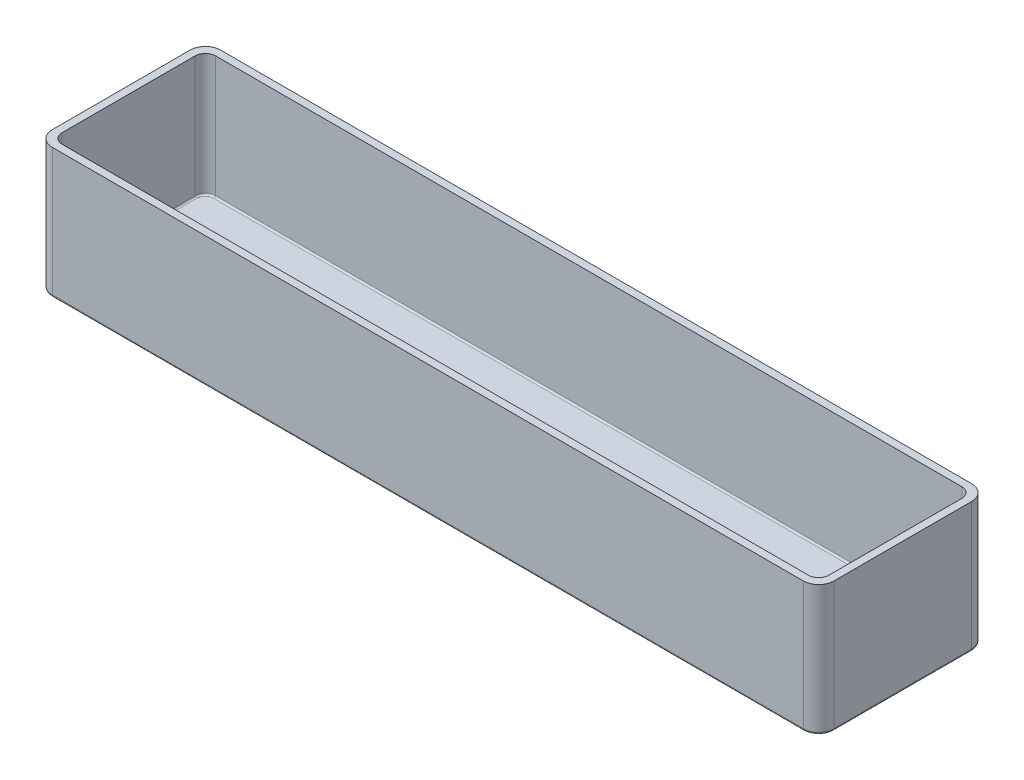
from build123d import *

# Parameters (mm, degrees)
SKETCH1_W           = 242.7986
SKETCH1_H           = 52.2986
SKETCH1_W_2         = 238.125
SKETCH1_H_2         = 47.625
BOSS_EXTRUDE1_DEPTH = 38.1
SKETCH2_W           = 242.7986
SKETCH2_H           = 52.2986
BOSS_EXTRUDE2_DEPTH = 2.3368
FILLET1_R           = 3.175
FILLET2_R           = 4.7625
SKETCH4_R           = 12.065
CUT_EXTRUDE2_DEPTH  = 131.601342739
FILLET4_R           = 0.508
FILLET5_R           = 0.762


with BuildPart() as part:
    # Sketch1 → Boss-Extrude1 (new body)
    with BuildSketch(Plane(origin=(0, 0, 0), x_dir=(1, 0, 0), z_dir=(0, 1, 0))):
        Rectangle(SKETCH1_W, SKETCH1_H)
        Rectangle(SKETCH1_W_2, SKETCH1_H_2, mode=Mode.SUBTRACT)
    extrude(amount=BOSS_EXTRUDE1_DEPTH)

    # Sketch2 → Boss-Extrude2 (add)
    with BuildSketch(Plane.XZ):
        Rectangle(SKETCH2_W, SKETCH2_H)
        with BuildLine():
            ThreePointArc((105.1493, 1.8243), (107.2493, 3.9243), (105.1493, 6.0243))
            ThreePointArc((105.1493, 6.0243), (103.0493, 3.9243), (105.1493, 1.8243))
        make_face(mode=Mode.SUBTRACT)
        with BuildLine():
            ThreePointArc((74.1493, 1.8243), (76.2493, 3.9243), (74.1493, 6.0243))
            ThreePointArc((74.1493, 6.0243), (72.0493, 3.9243), (74.1493, 1.8243))
        make_face(mode=Mode.SUBTRACT)
    extrude(amount=BOSS_EXTRUDE2_DEPTH)

    # Fillet1
    fillet1_edges = [part.edges().sort_by_distance(p)[0] for p in [
        (119.0625, 19.05, -23.8125),
        (119.0625, 19.05, 23.8125),
        (-119.0625, 19.05, 23.8125),
        (-119.0625, 19.05, -23.8125),
    ]]
    fillet(fillet1_edges, radius=FILLET1_R)

    # Fillet2
    fillet2_edges = [part.edges().sort_by_distance(p)[0] for p in [
        (-121.3993, 17.8816, -26.1493),
        (121.3993, 17.8816, -26.1493),
        (121.3993, 17.8816, 26.1493),
        (-121.3993, 17.8816, 26.1493),
    ]]
    fillet(fillet2_edges, radius=FILLET2_R)

    # Sketch4 → Cut-Extrude2 (cut, through all)
    with BuildSketch(Plane.XZ.offset(2.3368)):
        with Locations((89.6493, 3.9243)):
            Circle(SKETCH4_R)
    extrude(amount=-CUT_EXTRUDE2_DEPTH, mode=Mode.SUBTRACT)

    # Fillet4
    fillet4_edges = [part.edges().sort_by_distance(p)[0] for p in [
        (118.13256403, 0, -22.88256403),
        (119.0625, 0, 0),
        (118.13256403, 0, 22.88256403),
        (0, 0, 23.8125),
        (-118.13256403, 0, 22.88256403),
        (-119.0625, 0, 0),
        (-118.13256403, 0, -22.88256403),
        (0, 0, -23.8125),
    ]]
    fillet(fillet4_edges, radius=FILLET4_R)

    # Fillet5
    fillet5_edges = [part.edges().sort_by_distance(p)[0] for p in [
        (-120.004396045, -2.3368, 24.754396045),
        (0, -2.3368, 26.1493),
        (120.004396045, -2.3368, 24.754396045),
        (121.3993, -2.3368, 0),
        (120.004396045, -2.3368, -24.754396045),
        (0, -2.3368, -26.1493),
        (-120.004396045, -2.3368, -24.754396045),
        (-121.3993, -2.3368, 0),
    ]]
    fillet(fillet5_edges, radius=FILLET5_R)


solid = part.part
